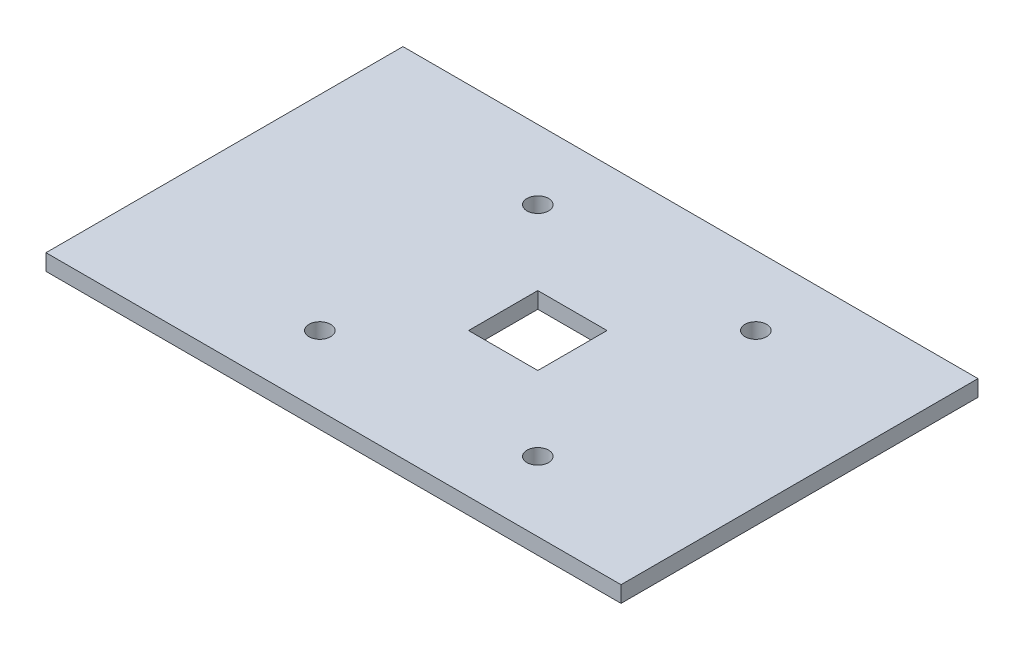
from build123d import *

# Parameters (mm, degrees)
SKETCH1_W           = 106.32
SKETCH1_H           = 66
SKETCH1_R           = 2
SKETCH1_W_2         = 12.8
SKETCH1_H_2         = 12.8
BOSS_EXTRUDE1_DEPTH = 3


with BuildPart() as part:
    # Sketch1 → Boss-Extrude1 (new body)
    with BuildSketch(Plane(origin=(0, 0, 0), x_dir=(1, 0, 0), z_dir=(0, 1, 0))):
        with Locations((-4.77, 0)):
            Rectangle(SKETCH1_W, SKETCH1_H)
        with Locations((20.152543264, -20.152543264)):
            Circle(SKETCH1_R, mode=Mode.SUBTRACT)
        with Locations((20.152543264, 20.152543264)):
            Circle(SKETCH1_R, mode=Mode.SUBTRACT)
        with Locations((-20.152543264, -20.152543264)):
            Circle(SKETCH1_R, mode=Mode.SUBTRACT)
        with Locations((-20.152543264, 20.152543264)):
            Circle(SKETCH1_R, mode=Mode.SUBTRACT)
        Rectangle(SKETCH1_W_2, SKETCH1_H_2, mode=Mode.SUBTRACT)
    extrude(amount=BOSS_EXTRUDE1_DEPTH)


solid = part.part
